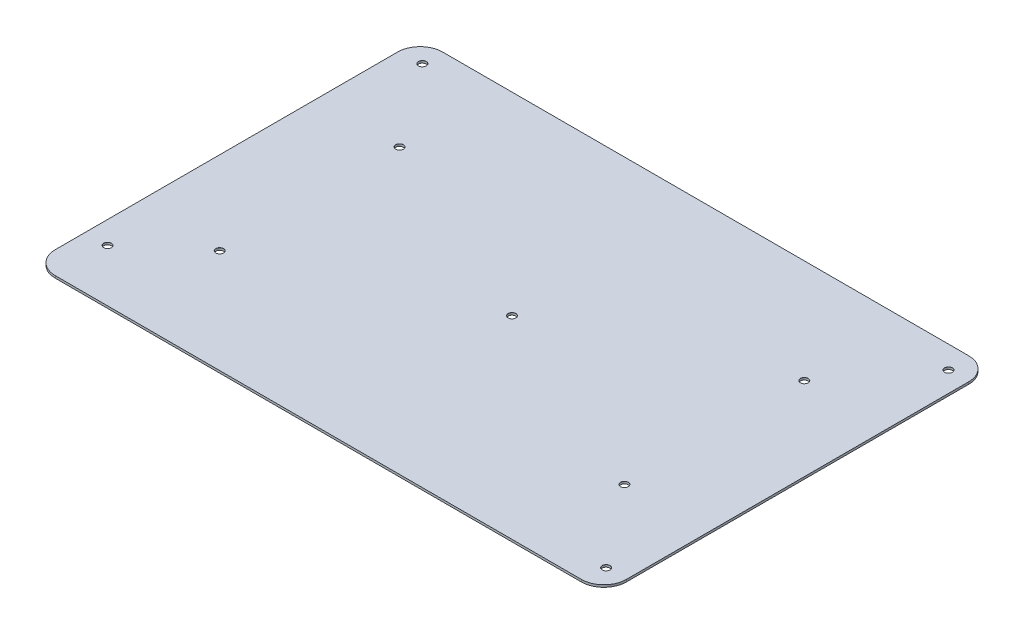
from build123d import *

# Parameters (mm, degrees)
SKETCH1_W                     = 254
SKETCH1_H                     = 172.27
BOSS_EXTRUDE1_DEPTH           = 1
FILLET1_R                     = 10
M3_CLEARANCE_HOLE1_AT_2_COUNT = 2
M3_CLEARANCE_HOLE1_AT_2_PITCH = 140
M3_CLEARANCE_HOLE1_AT_3_COUNT = 2
M3_CLEARANCE_HOLE1_AT_3_PITCH = 280.564953086
M3_CLEARANCE_HOLE1_AT_4_COUNT = 2
M3_CLEARANCE_HOLE1_AT_4_PITCH = 235.00212765
M3_CLEARANCE_HOLE1_AT_5_COUNT = 2
M3_CLEARANCE_HOLE1_AT_5_PITCH = 120.206523221
M3_CLEARANCE_HOLE1_AT_6_COUNT = 2
M3_CLEARANCE_HOLE1_AT_6_PITCH = 237.843663411
M3_CLEARANCE_HOLE1_AT_7_COUNT = 2
M3_CLEARANCE_HOLE1_AT_7_PITCH = 45.913050705
M3_CLEARANCE_HOLE1_AT_8_COUNT = 2
M3_CLEARANCE_HOLE1_AT_8_PITCH = 210.304560638
M3_CLEARANCE_HOLE1_AT_9_COUNT = 2
M3_CLEARANCE_HOLE1_AT_9_PITCH = 140.138532264


with BuildPart() as part:
    # Sketch1 → Boss-Extrude1 (new body)
    with BuildSketch(Plane(origin=(0, 0, 0), x_dir=(1, 0, 0), z_dir=(0, 1, 0))):
        Rectangle(SKETCH1_W, SKETCH1_H)
    extrude(amount=BOSS_EXTRUDE1_DEPTH)

    # Fillet1
    fillet1_edges = [part.edges().sort_by_distance(p)[0] for p in [
        (-127, 0.5, 86.135),
        (127, 0.5, 86.135),
        (127, 0.5, -86.135),
        (-127, 0.5, -86.135),
    ]]
    fillet(fillet1_edges, radius=FILLET1_R)

    # Sketch3 → M3 Clearance Hole1 (revolve, cut)
    with BuildSketch(Plane(origin=(-117, 1, -77.135), x_dir=(0, 0, 1), z_dir=(1, 0, 0))):
        Polygon((0, 0), (0, 1), (1.7, 1), (1.7, 0.025), (1.725, 0), align=None)
    m3_clearance_hole1 = revolve(axis=Axis((-117, 7.35, -77.135), (0, -1, 0)), mode=Mode.SUBTRACT)

    # M3 Clearance Hole1 at 2: M3 Clearance Hole1 ×2
    with Locations(*[(0, 0, i * M3_CLEARANCE_HOLE1_AT_2_PITCH) for i in range(1, M3_CLEARANCE_HOLE1_AT_2_COUNT)]):
        add(m3_clearance_hole1, mode=Mode.SUBTRACT)

    # M3 Clearance Hole1 at 3: M3 Clearance Hole1 ×2
    with Locations(*[Vector(0.8375957061471957, 0, 0.5462906122603433) * (i * M3_CLEARANCE_HOLE1_AT_3_PITCH) for i in range(1, M3_CLEARANCE_HOLE1_AT_3_COUNT)]):
        add(m3_clearance_hole1, mode=Mode.SUBTRACT)

    # M3 Clearance Hole1 at 4: M3 Clearance Hole1 ×2
    with Locations(*[Vector(0.9999909462524273, 0, 0.0042552806223507544) * (i * M3_CLEARANCE_HOLE1_AT_4_PITCH) for i in range(1, M3_CLEARANCE_HOLE1_AT_4_COUNT)]):
        add(m3_clearance_hole1, mode=Mode.SUBTRACT)

    # M3 Clearance Hole1 at 5: M3 Clearance Hole1 ×2
    with Locations(*[Vector(0.2246134342497294, 0, 0.9744479489200757) * (i * M3_CLEARANCE_HOLE1_AT_5_PITCH) for i in range(1, M3_CLEARANCE_HOLE1_AT_5_COUNT)]):
        add(m3_clearance_hole1, mode=Mode.SUBTRACT)

    # M3 Clearance Hole1 at 6: M3 Clearance Hole1 ×2
    with Locations(*[Vector(0.8703195915792332, 0, 0.49248736888711836) * (i * M3_CLEARANCE_HOLE1_AT_6_PITCH) for i in range(1, M3_CLEARANCE_HOLE1_AT_6_COUNT)]):
        add(m3_clearance_hole1, mode=Mode.SUBTRACT)

    # M3 Clearance Hole1 at 7: M3 Clearance Hole1 ×2
    with Locations(*[Vector(0.588068089261496, 0, 0.8088114257305797) * (i * M3_CLEARANCE_HOLE1_AT_7_PITCH) for i in range(1, M3_CLEARANCE_HOLE1_AT_7_COUNT)]):
        add(m3_clearance_hole1, mode=Mode.SUBTRACT)

    # M3 Clearance Hole1 at 8: M3 Clearance Hole1 ×2
    with Locations(*[Vector(0.9842867856615085, 0, 0.17657724534077357) * (i * M3_CLEARANCE_HOLE1_AT_8_PITCH) for i in range(1, M3_CLEARANCE_HOLE1_AT_8_COUNT)]):
        add(m3_clearance_hole1, mode=Mode.SUBTRACT)

    # M3 Clearance Hole1 at 9: M3 Clearance Hole1 ×2
    with Locations(*[Vector(0.8348881503904418, 0, 0.550419636584331) * (i * M3_CLEARANCE_HOLE1_AT_9_PITCH) for i in range(1, M3_CLEARANCE_HOLE1_AT_9_COUNT)]):
        add(m3_clearance_hole1, mode=Mode.SUBTRACT)


solid = part.part
